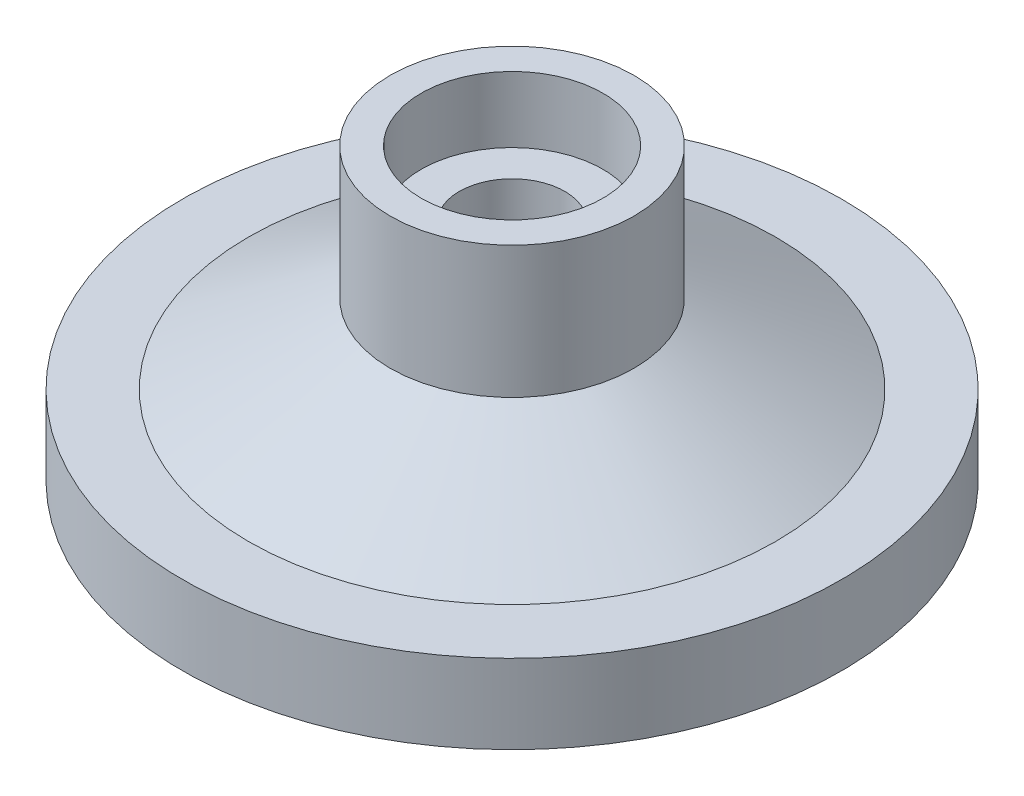
from build123d import *

# Parameters (mm, degrees)
SKETCH5_R          = 22
SKETCH7_R          = 15
SKETCH10_R         = 4
CUT_EXTRUDE1_DEPTH = 20
SKETCH11_R         = 6.9
CUT_EXTRUDE2_DEPTH = 5


with BuildPart() as part:
    # Sketch4 → Revolve1 (revolve)
    with BuildSketch(Plane.XY, mode=Mode.PRIVATE) as revolve1_sk:
        Polygon((25, 0), (25, 6), (20, 6), (9.25, 12), (9.25, 22), (0, 22), (0, 0), align=None)
    revolve(revolve1_sk.sketch.rotate(Axis((0, 0, 0), (0, 1, 0)), 90), axis=Axis((0, 0, 0), (0, 1, 0)))

    # Sketch5 → Cut-Loft1 section 0
    with BuildSketch(Plane.XZ):
        Circle(SKETCH5_R)
    # Sketch7 → Cut-Loft1 section 1
    with BuildSketch(Plane(origin=(0, 3, 0), x_dir=(-1, 0, 0), z_dir=(0, -1, 0))):
        Circle(SKETCH7_R)
    loft(mode=Mode.SUBTRACT)

    # Cut-Loft2: read off the stored shape, not the designer's step
    # Cut-Loft2: loft between two sections, ruled curve by curve
    cut_loft2_from = [
        Edge.make_bspline([(-3.999744183, 6, 0.04523797), (-4.090220122, 6, -7.954250395), (3.909268243, 6, -8.044726335), (3.999744183, 6, -0.04523797), (4.090220122, 6, 7.954250395), (-3.909268243, 6, 8.044726335), (-3.999744183, 6, 0.04523797)], [0, 0, 0, 0, 0.5, 0.5, 0.5, 1, 1, 1, 1], 3, [1, 0.333333333, 0.333333333, 1, 0.333333333, 0.333333333, 1]),
    ]
    cut_loft2_to = [
        Edge.make_bspline([(-14.242368289, 3, 4.706904028), (-23.656176345, 3, -23.777832549), (4.828560232, 3, -33.191640605), (14.242368289, 3, -4.706904028), (23.656176345, 3, 23.777832549), (-4.828560232, 3, 33.191640605), (-14.242368289, 3, 4.706904028)], [0, 0, 0, 0, 0.5, 0.5, 0.5, 1, 1, 1, 1], 3, [1, 0.333333333, 0.333333333, 1, 0.333333333, 0.333333333, 1]),
    ]
    cut_loft2 = Solid(Shell([*[Face.make_surface_from_curves(cut_loft2_from[k], cut_loft2_to[k]) for k in range(1)], Face(Wire(cut_loft2_from)), Face(Wire(cut_loft2_to))]))
    add(cut_loft2, mode=Mode.SUBTRACT)

    # Sketch10 → Cut-Extrude1 (cut)
    with BuildSketch(Plane.XZ.offset(-6)):
        with Locations(Location((0, 0, 0), (0, 0, 179.352))):
            Circle(SKETCH10_R)
    extrude(amount=-CUT_EXTRUDE1_DEPTH, mode=Mode.SUBTRACT)

    # Sketch11 → Cut-Extrude2 (cut)
    with BuildSketch(Plane(origin=(0, 22, 0), x_dir=(1, 0, 0), z_dir=(0, 1, 0))):
        with Locations(Location((0, 0, 0), (0, 0, 270))):
            Circle(SKETCH11_R)
    extrude(amount=-CUT_EXTRUDE2_DEPTH, mode=Mode.SUBTRACT)


solid = part.part
